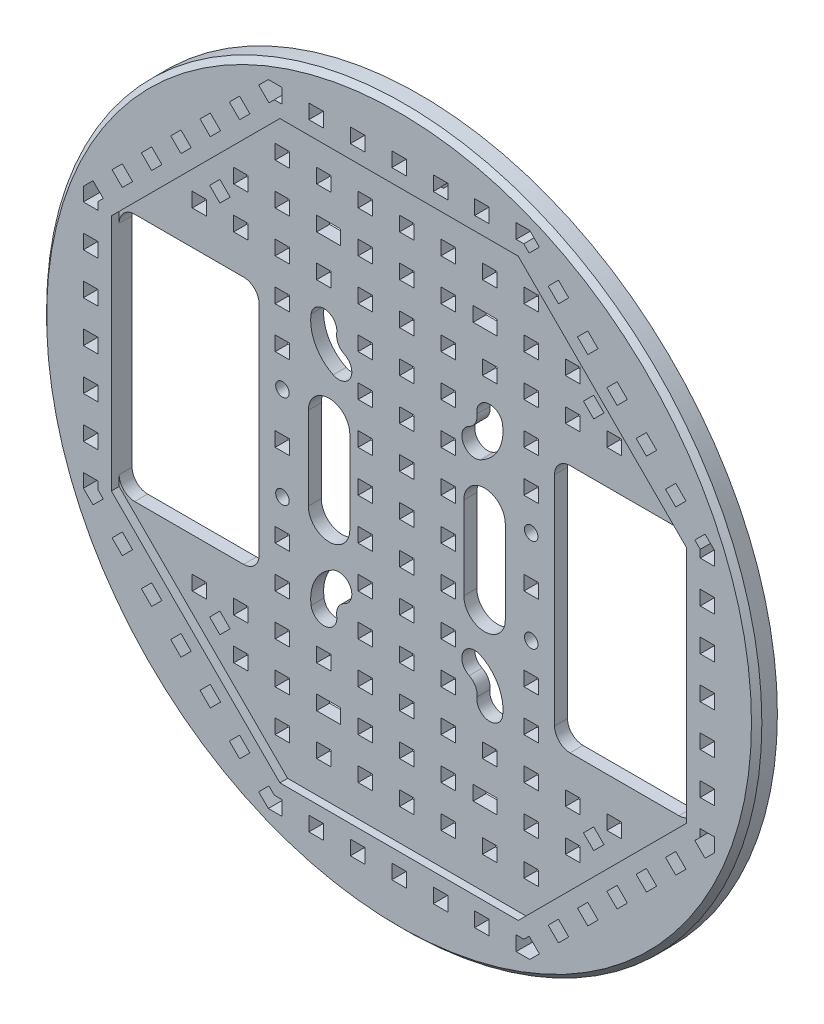
from build123d import *

# Parameters (mm, degrees)
RESSALTO_EXTRUS_O1_DEPTH     = 2.5
ESBO_O2_R                    = 1.3
ESBO_O2_R_2                  = 1.15
CORTE_EXTRUS_O1_DEPTH        = 90.837353033
CORTE_EXTRUS_O2_DEPTH        = 10.5
RESSALTO_EXTRUS_O2_DEPTH     = 1.5
ESBO_O5_W                    = 2.8
ESBO_O5_H                    = 2.8
CORTE_EXTRUS_O3_DEPTH        = 90.891601387
ESBO_O6_W                    = 2.8
ESBO_O6_H                    = 2.8
CORTE_EXTRUS_O4_DEPTH        = 90.891601387
RESSALTO_EXTRUS_O4_START     = -4
RESSALTO_EXTRUS_O4_OUTLINE_R = 69
RESSALTO_EXTRUS_O4_DEPTH     = 4
CHANFRO1_SIZE                = 1


# Read off the part's stored shape, not the designer's step: Ressalto-extrusão4
with BuildPart() as part:
    # Esboço1 → Ressalto-extrusão1 (new body)
    with BuildSketch(Plane.XY):
        Polygon((63.5, -26.302561211), (63.5, 26.302561211), (26.302561211, 63.5), (-26.302561211, 63.5), (-63.5, 26.302561211), (-63.5, -26.302561211), (-26.302561211, -63.5), (26.302561211, -63.5), align=None)
    extrude(amount=RESSALTO_EXTRUS_O1_DEPTH)

    # Esboço2 → Corte-extrusão1 (cut, through all)
    with BuildSketch(Plane(origin=(0, 0, 0), x_dir=(-1, 0, 0), z_dir=(0, 0, -1))):
        with Locations((24, 9)):
            Circle(ESBO_O2_R)
        with Locations(Location((24, -9, 0), (0, 0, 180))):
            Circle(ESBO_O2_R)
        with Locations((-24, -9)):
            Circle(ESBO_O2_R)
        with Locations(Location((-24, 9, 0), (0, 0, 180))):
            Circle(ESBO_O2_R)
        with Locations((-6.731, -57)):
            Circle(ESBO_O2_R_2)
        with Locations(Location((6.731, -57, 0), (0, 0, 180))):
            Circle(ESBO_O2_R_2)
        with Locations((6.731, 57)):
            Circle(ESBO_O2_R_2)
        with Locations(Location((-6.731, 57, 0), (0, 0, 180))):
            Circle(ESBO_O2_R_2)
        with BuildLine():
            Line((52.5, 24), (31.5, 24))
            ThreePointArc((31.5, 24), (29.378679656, 23.121320344), (28.5, 21))
            Line((28.5, 21), (28.5, -21))
            ThreePointArc((28.5, -21), (29.378679656, -23.121320344), (31.5, -24))
            Line((31.5, -24), (52.5, -24))
            ThreePointArc((52.5, -24), (54.621320344, -23.121320344), (55.5, -21))
            Line((55.5, -21), (55.5, 21))
            ThreePointArc((55.5, 21), (54.621320344, 23.121320344), (52.5, 24))
        make_face()
        with BuildLine():
            Line((-28.5, 21), (-28.5, -21))
            ThreePointArc((-28.5, -21), (-29.378679656, -23.121320344), (-31.5, -24))
            Line((-31.5, -24), (-52.5, -24))
            ThreePointArc((-52.5, -24), (-54.621320344, -23.121320344), (-55.5, -21))
            Line((-55.5, -21), (-55.5, 21))
            ThreePointArc((-55.5, 21), (-54.621320344, 23.121320344), (-52.5, 24))
            Line((-52.5, 24), (-31.5, 24))
            ThreePointArc((-31.5, 24), (-29.378679656, 23.121320344), (-28.5, 21))
        make_face()
    extrude(amount=-CORTE_EXTRUS_O1_DEPTH, mode=Mode.SUBTRACT)

    # Esboço4 → Corte-extrusão2 (cut)
    with BuildSketch(Plane.XY.offset(2.5)):
        Polygon((-36.062445841, 34.082546853), (-34.082546853, 36.062445841), (-36.062445841, 38.042344828), (-38.042344828, 36.062445841), align=None)
        Polygon((36.062445841, 34.082546853), (38.042344828, 36.062445841), (36.062445841, 38.042344828), (34.082546853, 36.062445841), align=None)
        Polygon((36.062445841, -38.042344828), (38.042344828, -36.062445841), (36.062445841, -34.082546853), (34.082546853, -36.062445841), align=None)
        Polygon((-36.062445841, -38.042344828), (-34.082546853, -36.062445841), (-36.062445841, -34.082546853), (-38.042344828, -36.062445841), align=None)
    extrude(amount=-CORTE_EXTRUS_O2_DEPTH, mode=Mode.SUBTRACT)

    # Esboço7 → Ressalto-extrusão2 (add)
    with BuildSketch(Plane.XY.offset(2.5)):
        Polygon((26.302561211, -63.5), (63.5, -26.302561211), (63.5, 26.302561211), (26.302561211, 63.5), (-26.302561211, 63.5), (-63.5, 26.302561211), (-63.5, -26.302561211), (-26.302561211, -63.5), align=None)
        Polygon((22.988852712, -55.5), (55.5, -22.988852712), (55.5, 22.988852712), (22.988852712, 55.5), (-22.988852712, 55.5), (-55.5, 22.988852712), (-55.5, -22.988852712), (-22.988852712, -55.5), align=None, mode=Mode.SUBTRACT)
    extrude(amount=RESSALTO_EXTRUS_O2_DEPTH)

    # Esboço5 → Corte-extrusão3 (cut, through all)
    with BuildSketch(Plane(origin=(0, 0, 0), x_dir=(-1, 0, 0), z_dir=(0, 0, -1))):
        Polygon((-47.72970773, -34.436100244), (-49.709606717, -36.415999231), (-47.72970773, -38.395898218), (-45.749808743, -36.415999231), align=None)
        Polygon((-42.072853481, -40.092954493), (-44.052752468, -42.072853481), (-42.072853481, -44.052752468), (-40.092954493, -42.072853481), align=None)
        Polygon((-53.38656198, -28.779245994), (-55.366460967, -30.759144982), (-53.38656198, -32.739043969), (-51.406662992, -30.759144982), align=None)
        with Locations((-8, 24)):
            Rectangle(ESBO_O5_W, ESBO_O5_H)
        Polygon((-25.225605949, -60.9), (-27.082189719, -59.043416229), (-25.102290732, -57.063517242), (-24.065807974, -58.1), (-22.6, -58.1), (-22.6, -60.9), align=None)
        Polygon((-30.759144982, -55.366460967), (-32.739043969, -53.38656198), (-30.759144982, -51.406662992), (-28.779245994, -53.38656198), align=None)
        Polygon((-36.415999231, -49.709606717), (-38.395898218, -47.72970773), (-36.415999231, -45.749808743), (-34.436100244, -47.72970773), align=None)
        with Locations((-8, 8)):
            Rectangle(ESBO_O5_W, ESBO_O5_H)
        with Locations((0, -59.5)):
            Rectangle(ESBO_O5_W, ESBO_O5_H)
        with Locations((-16, -59.5)):
            Rectangle(ESBO_O5_W, ESBO_O5_H)
        with Locations((8, 24)):
            Rectangle(ESBO_O5_W, ESBO_O5_H)
        with Locations((-8, 0)):
            Rectangle(ESBO_O5_W, ESBO_O5_H)
        with Locations((8, -24)):
            Rectangle(ESBO_O5_W, ESBO_O5_H)
        with Locations((-8, -24)):
            Rectangle(ESBO_O5_W, ESBO_O5_H)
        with Locations((-8, -8)):
            Rectangle(ESBO_O5_W, ESBO_O5_H)
        Polygon((24.065807974, -58.1), (25.102290732, -57.063517242), (27.082189719, -59.043416229), (25.225605949, -60.9), (22.6, -60.9), (22.6, -58.1), align=None)
        Polygon((60.9, -25.225605949), (59.043416229, -27.082189719), (57.063517242, -25.102290732), (58.1, -24.065807974), (58.1, -22.6), (60.9, -22.6), align=None)
        with Locations((59.5, -8)):
            Rectangle(ESBO_O5_W, ESBO_O5_H)
        with Locations((59.5, 0)):
            Rectangle(ESBO_O5_W, ESBO_O5_H)
        with Locations((16, -59.5)):
            Rectangle(ESBO_O5_W, ESBO_O5_H)
        with Locations((8, -8)):
            Rectangle(ESBO_O5_W, ESBO_O5_H)
        Polygon((34.436100244, -47.72970773), (36.415999231, -49.709606717), (38.395898218, -47.72970773), (36.415999231, -45.749808743), align=None)
        Polygon((40.092954493, -42.072853481), (42.072853481, -44.052752468), (44.052752468, -42.072853481), (42.072853481, -40.092954493), align=None)
        Polygon((28.779245994, -53.38656198), (30.759144982, -55.366460967), (32.739043969, -53.38656198), (30.759144982, -51.406662992), align=None)
        Polygon((55.366460967, -30.759144982), (53.38656198, -32.739043969), (51.406662992, -30.759144982), (53.38656198, -28.779245994), align=None)
        Polygon((49.709606717, -36.415999231), (47.72970773, -38.395898218), (45.749808743, -36.415999231), (47.72970773, -34.436100244), align=None)
        with Locations((59.5, -16)):
            Rectangle(ESBO_O5_W, ESBO_O5_H)
        with Locations((8, 0)):
            Rectangle(ESBO_O5_W, ESBO_O5_H)
        Polygon((58.1, 24.065807974), (57.063517242, 25.102290732), (59.043416229, 27.082189719), (60.9, 25.225605949), (60.9, 22.6), (58.1, 22.6), align=None)
        Polygon((47.72970773, 34.436100244), (49.709606717, 36.415999231), (47.72970773, 38.395898218), (45.749808743, 36.415999231), align=None)
        Polygon((42.072853481, 40.092954493), (44.052752468, 42.072853481), (42.072853481, 44.052752468), (40.092954493, 42.072853481), align=None)
        Polygon((53.38656198, 28.779245994), (55.366460967, 30.759144982), (53.38656198, 32.739043969), (51.406662992, 30.759144982), align=None)
        with Locations((59.5, 16)):
            Rectangle(ESBO_O5_W, ESBO_O5_H)
        Polygon((25.225605949, 60.9), (27.082189719, 59.043416229), (25.102290732, 57.063517242), (24.065807974, 58.1), (22.6, 58.1), (22.6, 60.9), align=None)
        Polygon((30.759144982, 55.366460967), (32.739043969, 53.38656198), (30.759144982, 51.406662992), (28.779245994, 53.38656198), align=None)
        Polygon((36.415999231, 49.709606717), (38.395898218, 47.72970773), (36.415999231, 45.749808743), (34.436100244, 47.72970773), align=None)
        with Locations((8, 8)):
            Rectangle(ESBO_O5_W, ESBO_O5_H)
        with Locations((16, 59.5)):
            Rectangle(ESBO_O5_W, ESBO_O5_H)
        with Locations((59.5, 8)):
            Rectangle(ESBO_O5_W, ESBO_O5_H)
        Polygon((-24.065807974, 58.1), (-25.102290732, 57.063517242), (-27.082189719, 59.043416229), (-25.225605949, 60.9), (-22.6, 60.9), (-22.6, 58.1), align=None)
        with Locations((-16, 59.5)):
            Rectangle(ESBO_O5_W, ESBO_O5_H)
        with Locations((-8, 59.5)):
            Rectangle(ESBO_O5_W, ESBO_O5_H)
        with Locations((0, 59.5)):
            Rectangle(ESBO_O5_W, ESBO_O5_H)
        Polygon((-34.436100244, 47.72970773), (-36.415999231, 49.709606717), (-38.395898218, 47.72970773), (-36.415999231, 45.749808743), align=None)
        Polygon((-40.092954493, 42.072853481), (-42.072853481, 44.052752468), (-44.052752468, 42.072853481), (-42.072853481, 40.092954493), align=None)
        Polygon((-28.779245994, 53.38656198), (-30.759144982, 55.366460967), (-32.739043969, 53.38656198), (-30.759144982, 51.406662992), align=None)
        Polygon((-55.366460967, 30.759144982), (-53.38656198, 32.739043969), (-51.406662992, 30.759144982), (-53.38656198, 28.779245994), align=None)
        Polygon((-49.709606717, 36.415999231), (-47.72970773, 38.395898218), (-45.749808743, 36.415999231), (-47.72970773, 34.436100244), align=None)
        Rectangle(ESBO_O5_W, ESBO_O5_H)
        with Locations((8, 59.5)):
            Rectangle(ESBO_O5_W, ESBO_O5_H)
        with Locations((8, -59.5)):
            Rectangle(ESBO_O5_W, ESBO_O5_H)
        with Locations((24, 0)):
            Rectangle(ESBO_O5_W, ESBO_O5_H)
        with Locations((-8, -59.5)):
            Rectangle(ESBO_O5_W, ESBO_O5_H)
        with Locations((8, 16)):
            Rectangle(ESBO_O5_W, ESBO_O5_H)
        with Locations((24, 16)):
            Rectangle(ESBO_O5_W, ESBO_O5_H)
        with Locations((16, 24)):
            Rectangle(ESBO_O5_W, ESBO_O5_H)
        with Locations((24, 24)):
            Rectangle(ESBO_O5_W, ESBO_O5_H)
        with Locations((8, 32)):
            Rectangle(ESBO_O5_W, ESBO_O5_H)
        with Locations((16, 32)):
            Rectangle(ESBO_O5_W, ESBO_O5_H)
        with Locations((24, 32)):
            Rectangle(ESBO_O5_W, ESBO_O5_H)
        with Locations((32, 32)):
            Rectangle(ESBO_O5_W, ESBO_O5_H)
        with Locations((40, 32)):
            Rectangle(ESBO_O5_W, ESBO_O5_H)
        with Locations((8, 40)):
            Rectangle(ESBO_O5_W, ESBO_O5_H)
        with Locations((16, 40)):
            Rectangle(ESBO_O5_W, ESBO_O5_H)
        with Locations((24, 40)):
            Rectangle(ESBO_O5_W, ESBO_O5_H)
        with Locations((32, 40)):
            Rectangle(ESBO_O5_W, ESBO_O5_H)
        with Locations((8, 48)):
            Rectangle(ESBO_O5_W, ESBO_O5_H)
        with Locations((16, 48)):
            Rectangle(ESBO_O5_W, ESBO_O5_H)
        with Locations((24, 48)):
            Rectangle(ESBO_O5_W, ESBO_O5_H)
        with Locations((0, 8)):
            Rectangle(ESBO_O5_W, ESBO_O5_H)
        with Locations((0, 16)):
            Rectangle(ESBO_O5_W, ESBO_O5_H)
        with Locations((0, 24)):
            Rectangle(ESBO_O5_W, ESBO_O5_H)
        with Locations((0, 32)):
            Rectangle(ESBO_O5_W, ESBO_O5_H)
        with Locations((0, 40)):
            Rectangle(ESBO_O5_W, ESBO_O5_H)
        with Locations((0, 48)):
            Rectangle(ESBO_O5_W, ESBO_O5_H)
        with Locations((-24, 48)):
            Rectangle(ESBO_O5_W, ESBO_O5_H)
        with Locations((-16, 48)):
            Rectangle(ESBO_O5_W, ESBO_O5_H)
        with Locations((-8, 48)):
            Rectangle(ESBO_O5_W, ESBO_O5_H)
        with Locations((-32, 40)):
            Rectangle(ESBO_O5_W, ESBO_O5_H)
        with Locations((-24, 40)):
            Rectangle(ESBO_O5_W, ESBO_O5_H)
        with Locations((-16, 40)):
            Rectangle(ESBO_O5_W, ESBO_O5_H)
        with Locations((-8, 40)):
            Rectangle(ESBO_O5_W, ESBO_O5_H)
        with Locations((-40, 32)):
            Rectangle(ESBO_O5_W, ESBO_O5_H)
        with Locations((-32, 32)):
            Rectangle(ESBO_O5_W, ESBO_O5_H)
        with Locations((-24, 32)):
            Rectangle(ESBO_O5_W, ESBO_O5_H)
        with Locations((-16, 32)):
            Rectangle(ESBO_O5_W, ESBO_O5_H)
        with Locations((-8, 32)):
            Rectangle(ESBO_O5_W, ESBO_O5_H)
        with Locations((-24, 24)):
            Rectangle(ESBO_O5_W, ESBO_O5_H)
        with Locations((-16, 24)):
            Rectangle(ESBO_O5_W, ESBO_O5_H)
        with Locations((-24, 16)):
            Rectangle(ESBO_O5_W, ESBO_O5_H)
        with Locations((-8, 16)):
            Rectangle(ESBO_O5_W, ESBO_O5_H)
        with Locations((-24, 0)):
            Rectangle(ESBO_O5_W, ESBO_O5_H)
        with Locations((40, -32)):
            Rectangle(ESBO_O5_W, ESBO_O5_H)
        with Locations((-40, -32)):
            Rectangle(ESBO_O5_W, ESBO_O5_H)
        with Locations((-8, -16)):
            Rectangle(ESBO_O5_W, ESBO_O5_H)
        with Locations((-24, -16)):
            Rectangle(ESBO_O5_W, ESBO_O5_H)
        with Locations((-16, -24)):
            Rectangle(ESBO_O5_W, ESBO_O5_H)
        with Locations((-24, -24)):
            Rectangle(ESBO_O5_W, ESBO_O5_H)
        with Locations((-8, -32)):
            Rectangle(ESBO_O5_W, ESBO_O5_H)
        with Locations((-16, -32)):
            Rectangle(ESBO_O5_W, ESBO_O5_H)
        with Locations((-24, -32)):
            Rectangle(ESBO_O5_W, ESBO_O5_H)
        with Locations((-32, -32)):
            Rectangle(ESBO_O5_W, ESBO_O5_H)
        with Locations((-8, -40)):
            Rectangle(ESBO_O5_W, ESBO_O5_H)
        with Locations((-16, -40)):
            Rectangle(ESBO_O5_W, ESBO_O5_H)
        with Locations((-24, -40)):
            Rectangle(ESBO_O5_W, ESBO_O5_H)
        with Locations((-32, -40)):
            Rectangle(ESBO_O5_W, ESBO_O5_H)
        with Locations((-8, -48)):
            Rectangle(ESBO_O5_W, ESBO_O5_H)
        with Locations((-16, -48)):
            Rectangle(ESBO_O5_W, ESBO_O5_H)
        with Locations((-24, -48)):
            Rectangle(ESBO_O5_W, ESBO_O5_H)
        with Locations((0, -48)):
            Rectangle(ESBO_O5_W, ESBO_O5_H)
        with Locations((0, -40)):
            Rectangle(ESBO_O5_W, ESBO_O5_H)
        with Locations((0, -32)):
            Rectangle(ESBO_O5_W, ESBO_O5_H)
        with Locations((0, -24)):
            Rectangle(ESBO_O5_W, ESBO_O5_H)
        with Locations((0, -16)):
            Rectangle(ESBO_O5_W, ESBO_O5_H)
        with Locations((0, -8)):
            Rectangle(ESBO_O5_W, ESBO_O5_H)
        with Locations((24, -48)):
            Rectangle(ESBO_O5_W, ESBO_O5_H)
        with Locations((16, -48)):
            Rectangle(ESBO_O5_W, ESBO_O5_H)
        with Locations((8, -48)):
            Rectangle(ESBO_O5_W, ESBO_O5_H)
        with Locations((32, -40)):
            Rectangle(ESBO_O5_W, ESBO_O5_H)
        with Locations((24, -40)):
            Rectangle(ESBO_O5_W, ESBO_O5_H)
        with Locations((16, -40)):
            Rectangle(ESBO_O5_W, ESBO_O5_H)
        with Locations((8, -40)):
            Rectangle(ESBO_O5_W, ESBO_O5_H)
        with Locations((32, -32)):
            Rectangle(ESBO_O5_W, ESBO_O5_H)
        with Locations((24, -32)):
            Rectangle(ESBO_O5_W, ESBO_O5_H)
        with Locations((16, -32)):
            Rectangle(ESBO_O5_W, ESBO_O5_H)
        with Locations((8, -32)):
            Rectangle(ESBO_O5_W, ESBO_O5_H)
        with Locations((24, -24)):
            Rectangle(ESBO_O5_W, ESBO_O5_H)
        with Locations((16, -24)):
            Rectangle(ESBO_O5_W, ESBO_O5_H)
        with Locations((24, -16)):
            Rectangle(ESBO_O5_W, ESBO_O5_H)
        with Locations((8, -16)):
            Rectangle(ESBO_O5_W, ESBO_O5_H)
        Polygon((-60.9, 25.225605949), (-59.043416229, 27.082189719), (-57.063517242, 25.102290732), (-58.1, 24.065807974), (-58.1, 22.6), (-60.9, 22.6), align=None)
        with Locations((-59.5, 8)):
            Rectangle(ESBO_O5_W, ESBO_O5_H)
        with Locations((-59.5, 16)):
            Rectangle(ESBO_O5_W, ESBO_O5_H)
        Polygon((-58.1, -24.065807974), (-57.063517242, -25.102290732), (-59.043416229, -27.082189719), (-60.9, -25.225605949), (-60.9, -22.6), (-58.1, -22.6), align=None)
        with Locations((-59.5, -16)):
            Rectangle(ESBO_O5_W, ESBO_O5_H)
        with Locations((-59.5, -8)):
            Rectangle(ESBO_O5_W, ESBO_O5_H)
        with Locations((-59.5, 0)):
            Rectangle(ESBO_O5_W, ESBO_O5_H)
    extrude(amount=-CORTE_EXTRUS_O3_DEPTH, mode=Mode.SUBTRACT)

    # Esboço6 → Corte-extrusão4 (cut, through all)
    with BuildSketch(Plane(origin=(0, 0, 0), x_dir=(-1, 0, 0), z_dir=(0, 0, -1))):
        with BuildLine():
            Line((-11, 8), (-11, -8))
            ThreePointArc((-11, -8), (-15, -12), (-19, -8))
            Line((-19, -8), (-19, 8))
            ThreePointArc((-19, 8), (-15, 12), (-11, 8))
        make_face()
        with BuildLine():
            Line((11, 8), (11, -8))
            ThreePointArc((11, -8), (15, -12), (19, -8))
            Line((19, -8), (19, 8))
            ThreePointArc((19, 8), (15, 12), (11, 8))
        make_face()
        with Locations((-14.2, 40)):
            Rectangle(ESBO_O6_W, ESBO_O6_H)
        with Locations((14.2, 40)):
            Rectangle(ESBO_O6_W, ESBO_O6_H)
        with Locations((14.2, -40)):
            Rectangle(ESBO_O6_W, ESBO_O6_H)
        with Locations((-14.2, -40)):
            Rectangle(ESBO_O6_W, ESBO_O6_H)
        with BuildLine():
            ThreePointArc((14.200297969, 16.315145811), (17.649253561, 19.637251237), (18.474772288, 24.354262787))
            ThreePointArc((18.474772288, 24.354262787), (15.645737213, 26.474772288), (13.525227712, 23.645737213))
            ThreePointArc((13.525227712, 23.645737213), (13.234515597, 21.984609051), (12.01994209, 20.814706705))
            ThreePointArc((12.01994209, 20.814706705), (10.860339583, 17.474748318), (14.200297969, 16.315145811))
        make_face()
        with BuildLine():
            ThreePointArc((-14.200297969, 16.315145811), (-17.649253561, 19.637251237), (-18.474772288, 24.354262787))
            ThreePointArc((-18.474772288, 24.354262787), (-15.645737213, 26.474772288), (-13.525227712, 23.645737213))
            ThreePointArc((-13.525227712, 23.645737213), (-13.234515597, 21.984609051), (-12.01994209, 20.814706705))
            ThreePointArc((-12.01994209, 20.814706705), (-10.860339583, 17.474748318), (-14.200297969, 16.315145811))
        make_face()
        with BuildLine():
            ThreePointArc((-14.200297969, -16.315145811), (-17.649253561, -19.637251237), (-18.474772288, -24.354262787))
            ThreePointArc((-18.474772288, -24.354262787), (-15.645737213, -26.474772288), (-13.525227712, -23.645737213))
            ThreePointArc((-13.525227712, -23.645737213), (-13.234515597, -21.984609051), (-12.01994209, -20.814706705))
            ThreePointArc((-12.01994209, -20.814706705), (-10.860339583, -17.474748318), (-14.200297969, -16.315145811))
        make_face()
        with BuildLine():
            ThreePointArc((14.200297969, -16.315145811), (17.649253561, -19.637251237), (18.474772288, -24.354262787))
            ThreePointArc((18.474772288, -24.354262787), (15.645737213, -26.474772288), (13.525227712, -23.645737213))
            ThreePointArc((13.525227712, -23.645737213), (13.234515597, -21.984609051), (12.01994209, -20.814706705))
            ThreePointArc((12.01994209, -20.814706705), (10.860339583, -17.474748318), (14.200297969, -16.315145811))
        make_face()
    extrude(amount=-CORTE_EXTRUS_O4_DEPTH, mode=Mode.SUBTRACT)

    # Ressalto-extrusão4 outline → Ressalto-extrusão4 (add)
    with BuildSketch(Plane(origin=(0, 0, 0), x_dir=(-1, 0, 0), z_dir=(0, 0, -1)).offset(RESSALTO_EXTRUS_O4_START)):
        Circle(RESSALTO_EXTRUS_O4_OUTLINE_R)
        Polygon((26.302561211, -63.5), (-26.302561211, -63.5), (-63.5, -26.302561211), (-63.5, 26.302561211), (-26.302561211, 63.5), (26.302561211, 63.5), (63.5, 26.302561211), (63.5, -26.302561211), align=None, mode=Mode.SUBTRACT)
    extrude(amount=RESSALTO_EXTRUS_O4_DEPTH)

    # Chanfro1
    chanfro1_edges = [part.edges().sort_by_distance(p)[0] for p in [
        (69, 0, 4),
    ]]
    chamfer(chanfro1_edges, length=CHANFRO1_SIZE)


solid = part.part
